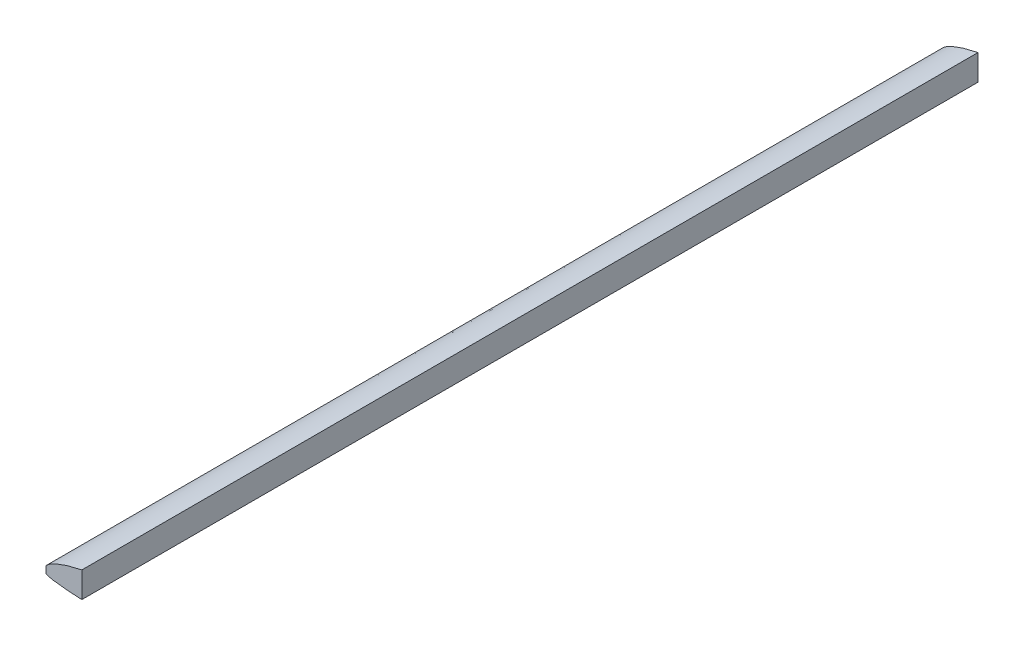
from build123d import *

# Parameters (mm, degrees)
STOCK_LEADING_START            = 146.05
STOCK_LEADING_RIB_BODY_1_DEPTH = 158.75
CUT_EXTRUDE1_DEPTH             = 15.24


# Read off the part's stored shape, not the designer's step: Stock-Leading rib body-1
with BuildPart() as part:
    # Stock-Leading rib body-1 outline → Stock-Leading rib body-1 (new body)
    with BuildSketch(Plane.XY.offset(STOCK_LEADING_START)):
        with BuildLine():
            Line((6.35, 3.381307893), (6.35, 7.936305639))
            add(Edge.make_bspline(
                [(6.35, 7.936305639), (6.009319534, 7.861180878), (5.051957159, 7.646943538), (3.570707886, 7.26907779), (2.126558515, 6.740774481), (0.91415771, 6.194600428), (0.314609795, 5.728416669), (0.046728414, 5.472683173), (9e-09, 5.426302614)],
                knots=[0.474331893, 0.474331893, 0.474331893, 0.474331893, 0.478015714, 0.484719936, 0.490901449, 0.496493482, 0.50193463, 0.503130574, 0.503130574, 0.503130574, 0.503130574], degree=3))
            Line((9e-09, 5.426302614), (-2e-09, 4.19416671))
            add(Edge.make_bspline(
                [(-2e-09, 4.19416671), (0.047371281, 4.176869278), (0.361036244, 4.065468917), (0.954407327, 3.830682548), (2.218770667, 3.717647253), (3.624578145, 3.502734879), (5.081120409, 3.460631155), (6.010518863, 3.402321821), (6.35, 3.381307893)],
                knots=[0.513595493, 0.513595493, 0.513595493, 0.513595493, 0.514195842, 0.517506907, 0.521314719, 0.52610709, 0.531740963, 0.534988738, 0.534988738, 0.534988738, 0.534988738], degree=3))
        make_face()
    extrude(amount=STOCK_LEADING_RIB_BODY_1_DEPTH)

    # Sketch1 → Cut-Extrude1 (cut)
    with BuildSketch(Plane(origin=(0, 0, 146.05), x_dir=(-1, 0, 0), z_dir=(0, 0, -1))):
        Polygon((-5.08, 7.064307893), (-5.08, 3.889307893), (-2.330369343, 5.476807893), align=None)
    extrude(amount=-CUT_EXTRUDE1_DEPTH, mode=Mode.SUBTRACT)


solid = part.part
